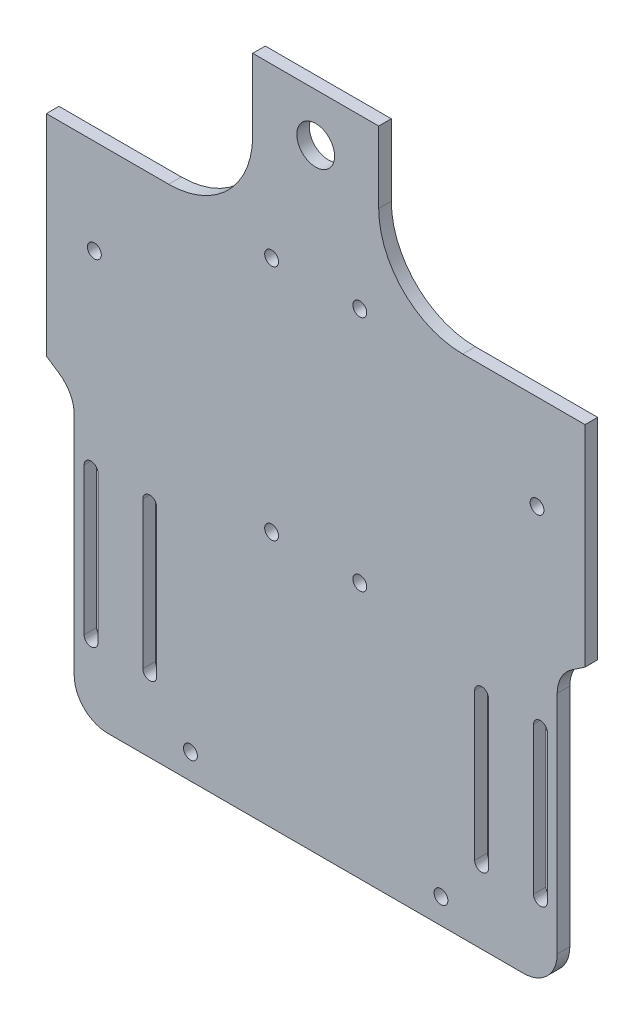
from build123d import *

# Parameters (mm, degrees)
SKETCH1_R           = 4.5
SKETCH1_R_2         = 1.65
BOSS_EXTRUDE1_DEPTH = 3
FILLET1_R           = 8
FILLET3_R           = 20


with BuildPart() as part:
    # Sketch1 → Boss-Extrude1 (new body)
    with BuildSketch(Plane.XY):
        Polygon((402.495772407, 1683.241435849), (402.495772407, 1633.241435849), (409.128072987, 1628.767892621), (409.128072987, 1618.767892621), (409.128072987, 1562.767892621), (524.128072987, 1562.767892621), (524.128072987, 1618.767892621), (524.128072987, 1628.767892621), (530.760373568, 1633.241435849), (530.760373568, 1683.241435849), (481.628072987, 1683.241435849), (481.628072987, 1720.241435849), (451.628072987, 1720.241435849), (451.628072987, 1683.241435849), align=None)
        with Locations((466.628072987, 1708.767892621)):
            Circle(SKETCH1_R, mode=Mode.SUBTRACT)
        with Locations((519.320878863, 1660.655786173)):
            Circle(SKETCH1_R_2, mode=Mode.SUBTRACT)
        with Locations((496.449751686, 1568.767892621)):
            Circle(SKETCH1_R_2, mode=Mode.SUBTRACT)
        with Locations((413.935267112, 1660.655786173)):
            Circle(SKETCH1_R_2, mode=Mode.SUBTRACT)
        with Locations((436.806394289, 1568.767892621)):
            Circle(SKETCH1_R_2, mode=Mode.SUBTRACT)
        with Locations((456.128072987, 1680.285786173)):
            Circle(SKETCH1_R_2, mode=Mode.SUBTRACT)
        with Locations((456.128072987, 1623.785786173)):
            Circle(SKETCH1_R_2, mode=Mode.SUBTRACT)
        with Locations((477.128072987, 1623.785786173)):
            Circle(SKETCH1_R_2, mode=Mode.SUBTRACT)
        with Locations((477.128072987, 1680.285786173)):
            Circle(SKETCH1_R_2, mode=Mode.SUBTRACT)
        with BuildLine():
            Line((414.778072987, 1615.267892621), (414.778072987, 1580.267892621))
            ThreePointArc((414.778072987, 1580.267892621), (413.128072987, 1578.617892621), (411.478072987, 1580.267892621))
            Line((411.478072987, 1580.267892621), (411.478072987, 1615.267892621))
            ThreePointArc((411.478072987, 1615.267892621), (413.128072987, 1616.917892621), (414.778072987, 1615.267892621))
        make_face(mode=Mode.SUBTRACT)
        with BuildLine():
            Line((518.478072987, 1615.267892621), (518.478072987, 1580.267892621))
            ThreePointArc((518.478072987, 1580.267892621), (520.128072987, 1578.617892621), (521.778072987, 1580.267892621))
            Line((521.778072987, 1580.267892621), (521.778072987, 1615.267892621))
            ThreePointArc((521.778072987, 1615.267892621), (520.128072987, 1616.917892621), (518.478072987, 1615.267892621))
        make_face(mode=Mode.SUBTRACT)
        with BuildLine():
            Line((428.778072987, 1615.267892621), (428.778072987, 1580.267892621))
            ThreePointArc((428.778072987, 1580.267892621), (427.128072987, 1578.617892621), (425.478072987, 1580.267892621))
            Line((425.478072987, 1580.267892621), (425.478072987, 1615.267892621))
            ThreePointArc((425.478072987, 1615.267892621), (427.128072987, 1616.917892621), (428.778072987, 1615.267892621))
        make_face(mode=Mode.SUBTRACT)
        with BuildLine():
            Line((504.478072987, 1615.267892621), (504.478072987, 1580.267892621))
            ThreePointArc((504.478072987, 1580.267892621), (506.128072987, 1578.617892621), (507.778072987, 1580.267892621))
            Line((507.778072987, 1580.267892621), (507.778072987, 1615.267892621))
            ThreePointArc((507.778072987, 1615.267892621), (506.128072987, 1616.917892621), (504.478072987, 1615.267892621))
        make_face(mode=Mode.SUBTRACT)
    extrude(amount=BOSS_EXTRUDE1_DEPTH)

    # Fillet1
    fillet1_edges = [part.edges().sort_by_distance(p)[0] for p in [
        (524.128072987, 1628.767892621, 1.5),
        (409.128072987, 1628.767892621, 1.5),
        (409.128072987, 1562.767892621, 1.5),
        (524.128072987, 1562.767892621, 1.5),
    ]]
    fillet(fillet1_edges, radius=FILLET1_R)

    # Fillet3
    fillet3_edges = [part.edges().sort_by_distance(p)[0] for p in [
        (481.628072987, 1683.241435849, 1.5),
        (451.628072987, 1683.241435849, 1.5),
    ]]
    fillet(fillet3_edges, radius=FILLET3_R)


solid = part.part
